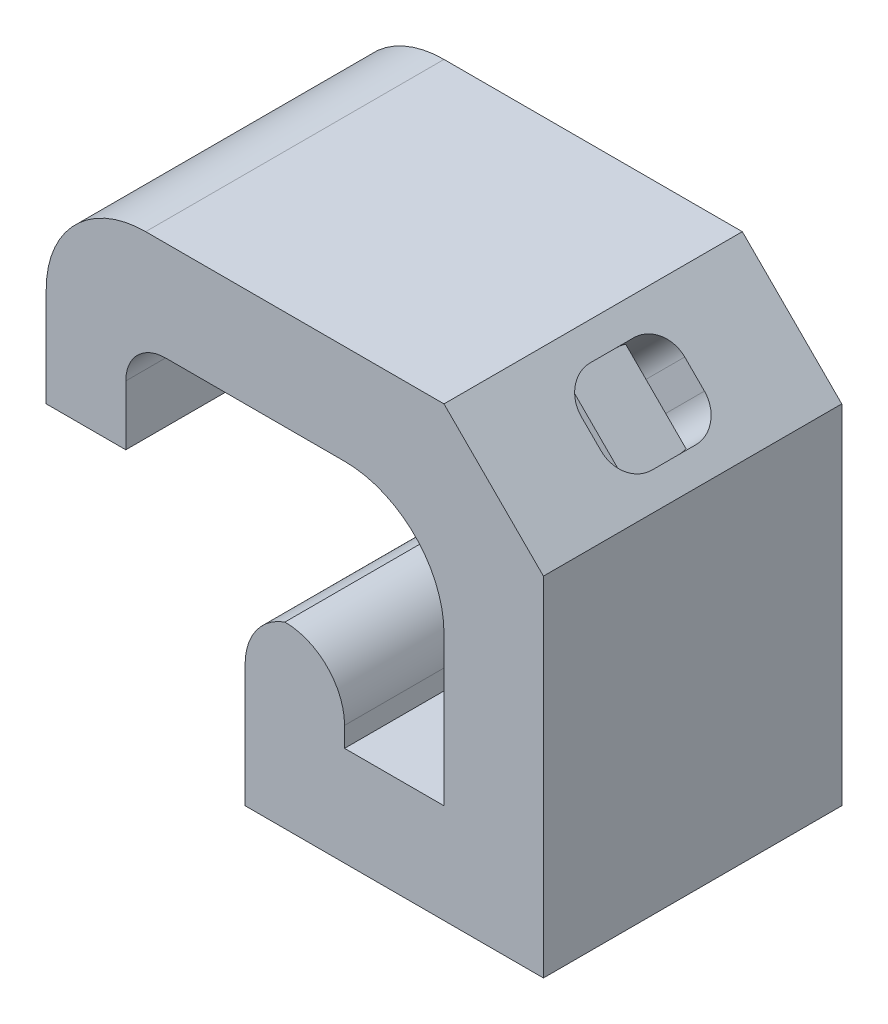
from build123d import *

# Parameters (mm, degrees)
BOSS_EXTRUDE1_DEPTH     = 15
FILLET1_R               = 5
CUT_EXTRUDE3_DEPTH      = 1.2
CUT_EXTRUDE4_DEPTH      = 35.323825544
CUT_EXTRUDE4_DEPTH_BACK = 10
FILLET2_R               = 3
FILLET3_R               = 3
FILLET4_R               = 5
FILLET5_R               = 2


with BuildPart() as part:
    # Sketch1 → Boss-Extrude1 (new body)
    with BuildSketch(Plane.XY):
        Polygon((0, 0), (0, 4), (-5, 4), (-5, -5), (10, -5), (10, 12.5), (5, 17.5), (-11, 17.5), (-15, 17.5), (-15, 7.5), (-11, 7.5), (-11, 12.5), (5, 12.5), (5, 0), align=None)
    extrude(amount=BOSS_EXTRUDE1_DEPTH)

    # Fillet1
    fillet1_edges = [part.edges().sort_by_distance(p)[0] for p in [
        (5, 12.5, 7.5),
    ]]
    fillet(fillet1_edges, radius=FILLET1_R)

    # Sketch2 → Cut-Extrude3 (cut)
    with BuildSketch(Plane(origin=(11.25, 11.25, 0), x_dir=(0, 0, -1), z_dir=(0.7071067811865487, 0.7071067811865465, 0))):
        with BuildLine():
            Line((-8.6, 7.503300859), (-6.4, 7.503300859))
            ThreePointArc((-6.4, 7.503300859), (-5.339339828, 7.063961031), (-4.9, 6.003300859))
            Line((-4.9, 6.003300859), (-4.9, 4.603300859))
            ThreePointArc((-4.9, 4.603300859), (-5.339339828, 3.542640687), (-6.4, 3.103300859))
            Line((-6.4, 3.103300859), (-8.6, 3.103300859))
            ThreePointArc((-8.6, 3.103300859), (-9.660660172, 3.542640687), (-10.1, 4.603300859))
            Line((-10.1, 4.603300859), (-10.1, 6.003300859))
            ThreePointArc((-10.1, 6.003300859), (-9.660660172, 7.063961031), (-8.6, 7.503300859))
        make_face()
    extrude(amount=-CUT_EXTRUDE3_DEPTH, mode=Mode.SUBTRACT)

    # Sketch2<5> → Cut-Extrude4 (cut, two sides: drawn at the far end of the back side and taken through both)
    with BuildSketch(Plane(origin=(11.25, 11.25, 0), x_dir=(0, 0, -1), z_dir=(0.7071067811865487, 0.7071067811865465, 0)).offset(-CUT_EXTRUDE4_DEPTH_BACK)):
        with BuildLine():
            Line((-9, 3.157617629), (-9, 7.448984088))
            ThreePointArc((-9, 7.448984088), (-9.793733639, 6.911595965), (-10.1, 6.003300859))
            Line((-10.1, 6.003300859), (-10.1, 4.603300859))
            ThreePointArc((-10.1, 4.603300859), (-9.793733639, 3.695005753), (-9, 3.157617629))
        make_face()
        with BuildLine():
            ThreePointArc((-4.9, 6.003300859), (-5.206266361, 6.911595965), (-6, 7.448984088))
            Line((-6, 7.448984088), (-6, 3.157617629))
            ThreePointArc((-6, 3.157617629), (-5.206266361, 3.695005753), (-4.9, 4.603300859))
            Line((-4.9, 4.603300859), (-4.9, 6.003300859))
        make_face()
    extrude(amount=CUT_EXTRUDE4_DEPTH + CUT_EXTRUDE4_DEPTH_BACK, mode=Mode.SUBTRACT)

    # Fillet2
    fillet2_edges = [part.edges().sort_by_distance(p)[0] for p in [
        (0, 4, 7.5),
    ]]
    fillet(fillet2_edges, radius=FILLET2_R)

    # Fillet3
    # the kernel refuses this fillet: 3 mm, written as the material it takes off along each edge
    with BuildSketch(Plane(origin=(-5, 4, -7.071067812), x_dir=(1, 0, 0), z_dir=(0, 0, 1))) as fillet3_piece_1:
        with BuildLine():
            CenterArc((3, -2.828427125), FILLET3_R, 109.471220634, 70.528779366)
            Line((0, -2.828427125), (-0.06, -2.828427125))
            Line((-0.06, -2.828427125), (-0.06, 0))
            Line((-0.06, 0), (0, 0.06))
            ThreePointArc((0, 0.06), (1, 0.06), (1.98, 0.056568542))
            Line((1.98, 0.056568542), (2, 0))
        make_face()
    extrude(amount=29.142135624, mode=Mode.SUBTRACT)

    # Fillet4
    fillet4_edges = [part.edges().sort_by_distance(p)[0] for p in [
        (-15, 17.5, 7.5),
    ]]
    fillet(fillet4_edges, radius=FILLET4_R)

    # Fillet5
    fillet5_edges = [part.edges().sort_by_distance(p)[0] for p in [
        (-11, 12.5, 7.5),
    ]]
    fillet(fillet5_edges, radius=FILLET5_R)


solid = part.part
